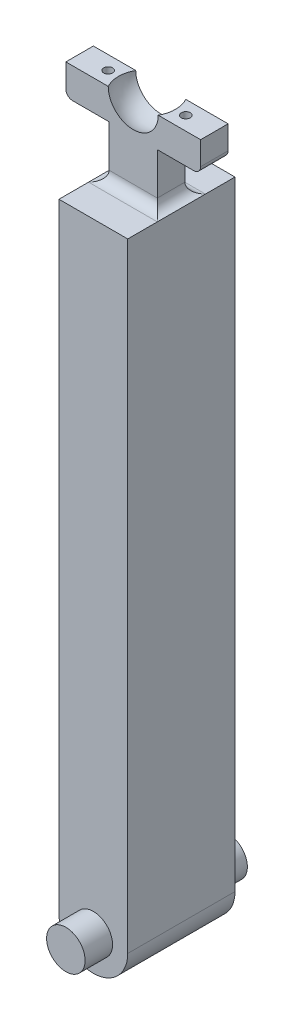
from build123d import *

# Parameters (mm, degrees)
EXTRUDE_1_DEPTH = 7.8
SKETCH_4_R      = 2.8
EXTRUDE_3_DEPTH = 4
SKETCH_5_W      = 7
SKETCH_5_H      = 4
EXTRUDE_4_DEPTH = 12
SKETCH_7_W      = 19.6
SKETCH_7_H      = 4.4
EXTRUDE_5_DEPTH = 2
FILLET_2_R      = 1
HOLE_WIZARD_1_D = 1.3
FILLET_3_R      = 1.5


with BuildPart() as part:
    # 草图1 → 凸台-拉伸1 (new, symmetric)
    with BuildSketch(Plane.XY):
        with BuildLine():
            Line((5, 0), (5, 90))
            Line((5, 90), (-5, 90))
            Line((-5, 90), (-5, 0))
            ThreePointArc((-5, 0), (0, -5), (5, 0))
        make_face()
    extrude(amount=EXTRUDE_1_DEPTH, both=True)

    # 草图4 → 凸台-拉伸3 (add)
    with BuildSketch(Plane.XY.offset(7.8)):
        Circle(SKETCH_4_R)
    extrude_3 = extrude(amount=EXTRUDE_3_DEPTH)

    # 草图5 → 凸台-拉伸4 (add)
    with BuildSketch(Plane(origin=(0, 102, 0), x_dir=(1, 0, 0), z_dir=(0, 1, 0))):
        Rectangle(SKETCH_5_W, SKETCH_5_H)
    extrude(amount=-EXTRUDE_4_DEPTH)

    # 草图7 → 凸台-拉伸5 (add, symmetric)
    with BuildSketch(Plane.XY):
        with Locations((0, 99.8)):
            Rectangle(SKETCH_7_W, SKETCH_7_H)
    extrude(amount=EXTRUDE_5_DEPTH, both=True)

    # 草图10 → 切除-旋转1 (revolve, cut)
    with BuildSketch(Plane.XY):
        with BuildLine():
            ThreePointArc((4.15, 102), (2.934493142, 104.934493142), (0, 106.15))
            Line((0, 106.15), (0, 102))
            Line((0, 102), (0, 97.85))
            ThreePointArc((0, 97.85), (2.934493142, 99.065506858), (4.15, 102))
        make_face()
    revolve(axis=Axis((0, 106.15, 0), (0, -1, 0)), mode=Mode.SUBTRACT)

    # 镜向2: 凸台-拉伸3 across plane
    add(extrude_3.mirror(Plane.XY))

    # 圆角2
    fillet_2_edges = [part.edges().sort_by_distance(p)[0] for p in [
        (-9.8, 97.6, 0),
        (9.8, 97.6, 0),
    ]]
    fillet(fillet_2_edges, radius=FILLET_2_R)

    # 孔1 (through all)
    with Locations(Plane(origin=(0, 97.6, 0), x_dir=(-1, 0, 0), z_dir=(0, -1, 0))):
        with Locations((5.65, 0), (-5.65, 0)):
            Hole(HOLE_WIZARD_1_D / 2)

    # 圆角3
    fillet_3_edges = [part.edges().sort_by_distance(p)[0] for p in [
        (0, 90, -2),
        (-3.5, 90, 0),
        (0, 90, 2),
        (3.5, 90, 0),
    ]]
    fillet(fillet_3_edges, radius=FILLET_3_R - 0.0001)  # a hair under: the kernel refuses the full size


solid = part.part
